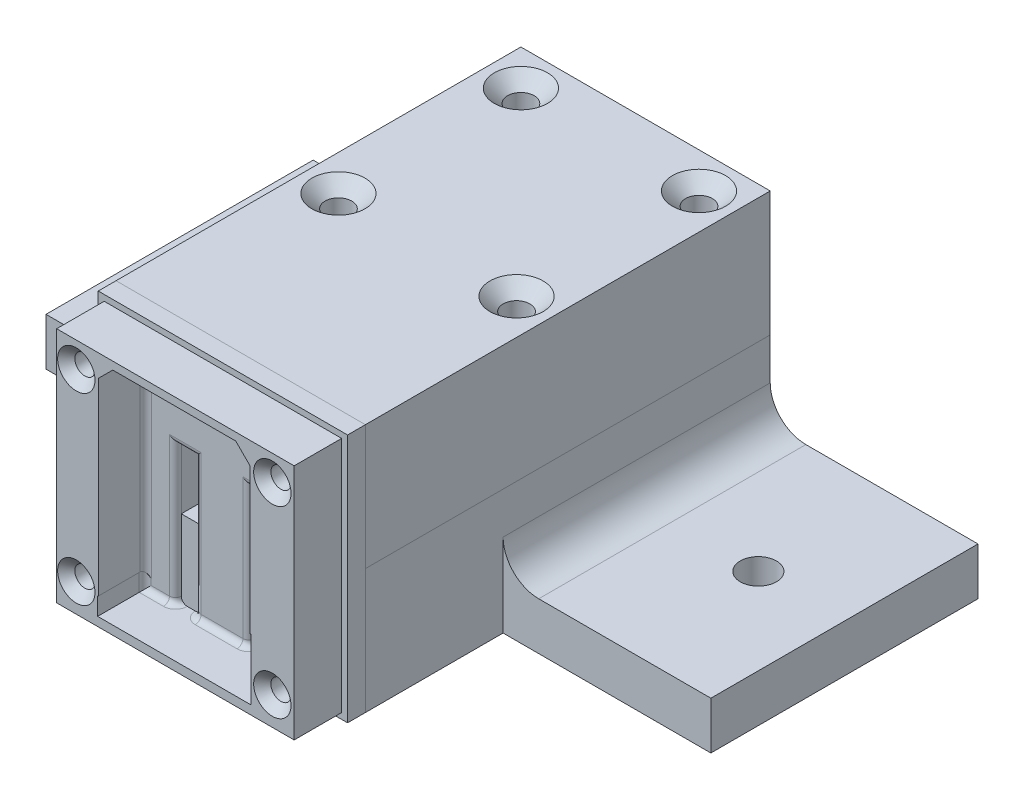
from build123d import *

# Parameters (mm, degrees)
BOSS_EXTRUDE1_DEPTH                          = 10
BOSS_EXTRUDE2_DEPTH                          = 10.1
BOSS_EXTRUDE3_DEPTH                          = 25
BOSS_EXTRUDE4_DEPTH                          = 10.1
BOSS_EXTRUDE5_DEPTH                          = 5
BOSS_EXTRUDE6_DEPTH                          = 8
SKETCH23_W                                   = 25
SKETCH23_H                                   = 12.5
BOSS_EXTRUDE10_DEPTH                         = 1
SKETCH11_W                                   = 42
SKETCH11_H                                   = 21
BOSS_EXTRUDE7_DEPTH                          = 3
BOSS_EXTRUDE14_START                         = -5.2
BOSS_EXTRUDE14_DEPTH                         = 5.2
CHAMFER1_SIZE                                = 2
SKETCH15_R                                   = 2.5
BOSS_EXTRUDE8_DEPTH                          = 3
SKETCH16_R                                   = 1.75
BOSS_EXTRUDE9_DEPTH                          = 2
CSK_FOR_M4_HEX_SOCKET_COUNTERSUNK_CA_2_COUNT = 2
CSK_FOR_M4_HEX_SOCKET_COUNTERSUNK_CA_2_PITCH = 30.736645967
CSK_FOR_M4_HEX_SOCKET_COUNTERSUNK_CA_3_COUNT = 2
CSK_FOR_M4_HEX_SOCKET_COUNTERSUNK_CA_3_PITCH = 42.950452911
CSK_FOR_M4_HEX_SOCKET_COUNTERSUNK_CA_4_COUNT = 2
CSK_FOR_M4_HEX_SOCKET_COUNTERSUNK_CA_4_PITCH = 30
SKETCH19_R                                   = 1.25
CUT_EXTRUDE1_DEPTH                           = 6
SKETCH28_W                                   = 45
SKETCH28_H                                   = 8
BOSS_EXTRUDE15_DEPTH                         = 35
SKETCH32_W                                   = 45
SKETCH32_H                                   = 8
BOSS_EXTRUDE16_DEPTH                         = 35
FILLET1_R                                    = 6
SKETCH31_R                                   = 3.05
CUT_EXTRUDE3_DEPTH                           = 35
SKETCH34_W                                   = 40
SKETCH34_H                                   = 40
BOSS_EXTRUDE17_DEPTH                         = 8
CUT_EXTRUDE2_DEPTH                           = 5
CUT_EXTRUDE2_DEPTH_BACK                      = 10
SKETCH20_W                                   = 3.943705391
SKETCH20_H                                   = 10.51654771
SKETCH20_W_2                                 = 3.341855227
SKETCH20_H_2                                 = 10.586808403
SKETCH37_W                                   = 23.5
SKETCH37_H                                   = 3.007435126
CUT_EXTRUDE5_DEPTH                           = 8
SKETCH38_W                                   = 3.341855227
SKETCH38_H                                   = 13.012197934
SKETCH38_W_2                                 = 3.943705391
SKETCH38_H_2                                 = 13.082458627
CUT_EXTRUDE6_DEPTH                           = 1
FILLET2_R                                    = 1
CUT_EXTRUDE7_DEPTH                           = 6
CSK_FOR_M3_COUNTERSUNK_FLAT_HEAD_SCR_2_COUNT = 2
CSK_FOR_M3_COUNTERSUNK_FLAT_HEAD_SCR_2_PITCH = 30.950031983
CSK_FOR_M3_COUNTERSUNK_FLAT_HEAD_SCR_3_COUNT = 2
CSK_FOR_M3_COUNTERSUNK_FLAT_HEAD_SCR_3_PITCH = 45.258406241
CSK_FOR_M3_COUNTERSUNK_FLAT_HEAD_SCR_4_COUNT = 2
CSK_FOR_M3_COUNTERSUNK_FLAT_HEAD_SCR_4_PITCH = 33.021490816
SKETCH43_R                                   = 1
BOSS_EXTRUDE18_DEPTH                         = 3
SKETCH43_2_R                                 = 1
CUT_EXTRUDE8_DEPTH                           = 3.2


with BuildPart() as part:
    # Sketch1 → Boss-Extrude1 (new body)
    with BuildSketch(Plane.XY):
        with BuildLine():
            Line((0, 21), (0, 0))
            Line((0, 0), (42, 0))
            Line((42, 0), (42, 21))
            Line((42, 21), (27.1, 21))
            ThreePointArc((27.1, 21), (21, 14.9), (14.9, 21))
            Line((14.9, 21), (0, 21))
        make_face()
    extrude(amount=BOSS_EXTRUDE1_DEPTH)

    # Sketch2 → Boss-Extrude2 (add)
    with BuildSketch(Plane.XY.offset(10)):
        with BuildLine():
            Line((0, 21), (0, 0))
            Line((0, 0), (42, 0))
            Line((42, 0), (42, 21))
            Line((42, 21), (37.2, 21))
            ThreePointArc((37.2, 21), (21, 4.8), (4.8, 21))
            Line((4.8, 21), (0, 21))
        make_face()
    extrude(amount=BOSS_EXTRUDE2_DEPTH)

    # Sketch3 → Boss-Extrude3 (add)
    with BuildSketch(Plane.XY.offset(20.1)):
        with BuildLine():
            Line((14.9, 21), (4.8, 21))
            ThreePointArc((4.8, 21), (21, 4.8), (37.2, 21))
            Line((37.2, 21), (27.1, 21))
            ThreePointArc((27.1, 21), (21, 14.9), (14.9, 21))
        make_face()
        with BuildLine():
            Line((42, 21), (37.2, 21))
            ThreePointArc((37.2, 21), (21, 4.8), (4.8, 21))
            Line((4.8, 21), (0, 21))
            Line((0, 21), (0, 0))
            Line((0, 0), (42, 0))
            Line((42, 0), (42, 21))
        make_face()
    extrude(amount=BOSS_EXTRUDE3_DEPTH)

    # Sketch4 → Boss-Extrude4 (add)
    with BuildSketch(Plane.XY.offset(45.1)):
        with BuildLine():
            Line((0, 21), (0, 0))
            Line((0, 0), (42, 0))
            Line((42, 0), (42, 21))
            Line((42, 21), (37.2, 21))
            ThreePointArc((37.2, 21), (21, 4.8), (4.8, 21))
            Line((4.8, 21), (0, 21))
        make_face()
    extrude(amount=BOSS_EXTRUDE4_DEPTH)

    # Sketch7 → Boss-Extrude5 (add)
    with BuildSketch(Plane.XY.offset(55.2)):
        with BuildLine():
            Line((14.9, 21), (4.8, 21))
            ThreePointArc((4.8, 21), (21, 4.8), (37.2, 21))
            Line((37.2, 21), (27.1, 21))
            ThreePointArc((27.1, 21), (21, 14.9), (14.9, 21))
        make_face()
        with BuildLine():
            Line((42, 21), (37.2, 21))
            ThreePointArc((37.2, 21), (21, 4.8), (4.8, 21))
            Line((4.8, 21), (0, 21))
            Line((0, 21), (0, 0))
            Line((0, 0), (42, 0))
            Line((42, 0), (42, 21))
        make_face()
    extrude(amount=BOSS_EXTRUDE5_DEPTH)

    # Sketch9 → Boss-Extrude6 (add)
    with BuildSketch(Plane.XY.offset(60.2)):
        Polygon((33.5, 21), (33.5, 8.5), (8.5, 8.5), (8.5, 21), (0, 21), (0, 0), (42, 0), (42, 21), align=None)
    extrude(amount=BOSS_EXTRUDE6_DEPTH)

    # Sketch11 → Boss-Extrude7 (add)
    with BuildSketch(Plane.XY.offset(68.2)):
        with Locations((21, 10.5)):
            Rectangle(SKETCH11_W, SKETCH11_H)
    extrude(amount=BOSS_EXTRUDE7_DEPTH)


with BuildPart() as body_2:
    # Sketch23 → Boss-Extrude10 (new body)
    with BuildSketch(Plane.XY.offset(68.2)):
        with Locations((21, 14.75)):
            Rectangle(SKETCH23_W, SKETCH23_H)
    extrude(amount=-BOSS_EXTRUDE10_DEPTH)


with BuildPart() as body_3:
    # Split1: the piece on the far side of the plane
    add(part.part)
    split(bisect_by=Plane(origin=(0, 0, 68.2), x_dir=(-1, 0, 0), z_dir=(0, 0, -1)), keep=Keep.BOTTOM)


with BuildPart() as part_1:
    add(part.part)

    # Split1
    split(bisect_by=Plane(origin=(0, 0, 68.2), x_dir=(-1, 0, 0), z_dir=(0, 0, -1)), keep=Keep.TOP)

    # Sketch27 → Boss-Extrude14 (add)
    with BuildSketch(Plane.XY.offset(BOSS_EXTRUDE14_START)):
        with BuildLine():
            ThreePointArc((11.363884136, 21), (21, 11.363884136), (30.636115864, 21))
            Line((30.636115864, 21), (27.1, 21))
            ThreePointArc((27.1, 21), (21, 14.9), (14.9, 21))
            Line((14.9, 21), (11.363884136, 21))
        make_face()
    extrude(amount=BOSS_EXTRUDE14_DEPTH)

    # Chamfer1
    chamfer1_edges = [part_1.edges().sort_by_distance(p)[0] for p in [
        (21, 11.363884136, -5.2),
    ]]
    chamfer(chamfer1_edges, length=CHAMFER1_SIZE)


with BuildPart() as body_4:
    # Mirror2: mirrored copy
    add(part_1.part.mirror(Plane(origin=(0, 21, 0), x_dir=(0, 0, 1), z_dir=(0, -1, 0))))


with BuildPart() as body_5:
    # Mirror2 2: mirrored copy
    add(body_2.part.mirror(Plane(origin=(0, 21, 0), x_dir=(0, 0, 1), z_dir=(0, -1, 0))))


with BuildPart() as body_6:
    # Mirror2 3: mirrored copy
    add(body_3.part.mirror(Plane(origin=(0, 21, 0), x_dir=(0, 0, 1), z_dir=(0, -1, 0))))

    # Combine1: union body 3, body 2, body 5
    add(body_3.part)
    add(body_2.part)
    add(body_5.part)

    # Sketch15 → Boss-Extrude8 (add)
    with BuildSketch(Plane(origin=(0, 0, 68.2), x_dir=(-1, 0, 0), z_dir=(0, 0, -1))):
        with Locations((-29, 29)):
            Circle(SKETCH15_R)
        with Locations((-13, 29)):
            Circle(SKETCH15_R)
        with Locations((-13, 13)):
            Circle(SKETCH15_R)
        with Locations((-29, 13)):
            Circle(SKETCH15_R)
    extrude(amount=BOSS_EXTRUDE8_DEPTH)

    # Sketch16 → Boss-Extrude9 (add)
    with BuildSketch(Plane(origin=(0, 0, 65.2), x_dir=(-1, 0, 0), z_dir=(0, 0, -1))):
        with Locations((-13, 13)):
            Circle(SKETCH16_R)
        with Locations((-29, 13)):
            Circle(SKETCH16_R)
        with Locations((-13, 29)):
            Circle(SKETCH16_R)
        with Locations((-29, 29)):
            Circle(SKETCH16_R)
    extrude(amount=BOSS_EXTRUDE9_DEPTH)

    # Sketch19 → Cut-Extrude1 (cut)
    with BuildSketch(Plane(origin=(0, 0, 63.2), x_dir=(-1, 0, 0), z_dir=(0, 0, -1))):
        with Locations((-29, 29)):
            Circle(SKETCH19_R)
        with Locations((-13, 29)):
            Circle(SKETCH19_R)
        with Locations((-13, 13)):
            Circle(SKETCH19_R)
        with Locations((-29, 13)):
            Circle(SKETCH19_R)
    extrude(amount=-CUT_EXTRUDE1_DEPTH, mode=Mode.SUBTRACT)

    # Sketch34 → Boss-Extrude17 (add)
    with BuildSketch(Plane.XY.offset(71.2)):
        with Locations((21, 21)):
            Rectangle(SKETCH34_W, SKETCH34_H)
    extrude(amount=BOSS_EXTRUDE17_DEPTH)

    # Sketch20 → Cut-Extrude2 (cut, two sides: drawn at the far end of the back side and taken through both)
    with BuildSketch(Plane(origin=(0, 0, 68.2), x_dir=(-1, 0, 0), z_dir=(0, 0, -1)).offset(-CUT_EXTRUDE2_DEPTH_BACK)):
        with Locations((-27.344221717, 20.828534548)):
            Rectangle(SKETCH20_W, SKETCH20_H)
        with Locations((-14.670927613, 20.793404202)):
            Rectangle(SKETCH20_W_2, SKETCH20_H_2)
    extrude(amount=CUT_EXTRUDE2_DEPTH + CUT_EXTRUDE2_DEPTH_BACK, mode=Mode.SUBTRACT)

    # Sketch37 → Cut-Extrude5 (cut)
    with BuildSketch(Plane.XY.offset(79.2)):
        with BuildLine():
            Line((16.453504002, 5.495237192), (25.653504002, 5.495237192))
            Line((25.653504002, 5.495237192), (25.653504002, 6.145237192))
            ThreePointArc((25.653504002, 6.145237192), (25.448478749, 6.640211939), (24.953504002, 6.845237192))
            Line((24.953504002, 6.845237192), (17.153504002, 6.845237192))
            ThreePointArc((17.153504002, 6.845237192), (16.658529255, 6.640211939), (16.453504002, 6.145237192))
            Line((16.453504002, 6.145237192), (16.453504002, 5.495237192))
        make_face()
        with Locations((19.653504002, 3.991519629)):
            Rectangle(SKETCH37_W, SKETCH37_H)
        with BuildLine():
            Line((32.603504002, 12.795237192), (33.703504002, 12.795237192))
            Line((33.703504002, 12.795237192), (33.703504002, 2.487802066))
            Line((33.703504002, 2.487802066), (31.403504002, 2.487802066))
            Line((31.403504002, 2.487802066), (31.403504002, 5.495237192))
            Line((31.403504002, 5.495237192), (31.403504002, 11.595237192))
            ThreePointArc((31.403504002, 11.595237192), (31.754975865, 12.44376533), (32.603504002, 12.795237192))
        make_face()
        with BuildLine():
            Line((32.603504002, 12.795237192), (33.603504002, 12.795237192))
            Line((33.603504002, 12.795237192), (33.603504002, 37.253815836))
            Line((33.603504002, 37.253815836), (31.162082646, 39.695237192))
            Line((31.162082646, 39.695237192), (10.444925358, 39.695237192))
            Line((10.444925358, 39.695237192), (8.003504002, 37.253815836))
            Line((8.003504002, 37.253815836), (8.003504002, 5.495237192))
            Line((8.003504002, 5.495237192), (16.453504002, 5.495237192))
            Line((16.453504002, 5.495237192), (16.453504002, 6.145237192))
            ThreePointArc((16.453504002, 6.145237192), (16.658529255, 6.640211939), (17.153504002, 6.845237192))
            Line((17.153504002, 6.845237192), (24.953504002, 6.845237192))
            ThreePointArc((24.953504002, 6.845237192), (25.448478749, 6.640211939), (25.653504002, 6.145237192))
            Line((25.653504002, 6.145237192), (25.653504002, 5.495237192))
            Line((25.653504002, 5.495237192), (31.403504002, 5.495237192))
            Line((31.403504002, 5.495237192), (31.403504002, 11.595237192))
            ThreePointArc((31.403504002, 11.595237192), (31.754975865, 12.44376533), (32.603504002, 12.795237192))
        make_face()
    extrude(amount=-CUT_EXTRUDE5_DEPTH, mode=Mode.SUBTRACT)

    # Sketch38 → Cut-Extrude6 (cut)
    with BuildSketch(Plane.XY.offset(71.2)):
        with Locations((14.670927613, 8.993901033)):
            Rectangle(SKETCH38_W, SKETCH38_H)
        with Locations((27.344221717, 9.02903138)):
            Rectangle(SKETCH38_W_2, SKETCH38_H_2)
    extrude(amount=-CUT_EXTRUDE6_DEPTH, mode=Mode.SUBTRACT)

    # Fillet2
    fillet2_edges = [body_6.edges().sort_by_distance(p)[0] for p in [
        (27.344221716, 26.086808403, 71.2),
        (10.451752001, 2.487802066, 71.2),
        (7.903504002, 3.991519629, 71.2),
        (8.003504002, 21.374526514, 71.2),
        (9.22421468, 38.474526514, 71.2),
        (20.803504002, 39.695237192, 71.2),
        (32.382793324, 38.474526514, 71.2),
        (33.603504002, 25.024526514, 71.2),
        (16.341855227, 14.287305234, 71.2),
        (14.670927613, 26.086808403, 71.2),
        (13, 14.287305234, 71.2),
        (29.316074412, 14.287305234, 71.2),
        (25.372369021, 14.287305234, 71.2),
        (33.653504002, 12.795237192, 71.2),
        (33.703504002, 7.641519629, 71.2),
        (7.953504002, 5.495237192, 71.2),
        (20.857112124, 2.487802066, 71.2),
        (31.509789207, 2.487802066, 71.2),
        (13, 2.487802066, 70.7),
        (16.341855227, 2.487802066, 70.7),
        (25.372369021, 2.487802066, 70.7),
        (29.316074412, 2.487802066, 70.7),
    ]]
    fillet(fillet2_edges, radius=FILLET2_R - 0.0001)  # a hair under: the kernel refuses the full size


with BuildPart() as csk_for_m4_hex_socket_countersunk_cap_sc_tool:
    # Sketch18 → CSK for M4 Hex Socket Countersunk Cap Screw1 (revolve)
    with BuildSketch(Plane(origin=(36, 42, 36.736645967), x_dir=(0, 0, 1), z_dir=(1, 0, 0))):
        Polygon((0, 0), (0, 42), (2.25, 42), (2.25, 2.23), (4.48, 0), align=None)
    csk_for_m4_hex_socket_countersunk_cap_sc = revolve(axis=Axis((36, 48.35, 36.736645967), (0, -1, 0)))


with BuildPart() as part_2:
    add(part_1.part)

    # CSK for M4 Hex Socket Countersunk Cap Screw1: cut by csk_for_m4_hex_socket_countersunk_cap_sc_tool
    add(csk_for_m4_hex_socket_countersunk_cap_sc_tool.part, mode=Mode.SUBTRACT)


with BuildPart() as body_4_1:
    add(body_4.part)

    # CSK for M4 Hex Socket Countersunk Cap Screw1: cut by csk_for_m4_hex_socket_countersunk_cap_sc_tool
    add(csk_for_m4_hex_socket_countersunk_cap_sc_tool.part, mode=Mode.SUBTRACT)


with BuildPart() as csk_for_m4_hex_socket_countersunk_ca_2_tool:
    # CSK for M4 Hex Socket Countersunk Ca 2: CSK for M4 Hex Socket Countersunk Cap Screw1 ×2
    with Locations(*[(0, 0, -i * CSK_FOR_M4_HEX_SOCKET_COUNTERSUNK_CA_2_PITCH) for i in range(1, CSK_FOR_M4_HEX_SOCKET_COUNTERSUNK_CA_2_COUNT)]):
        add(csk_for_m4_hex_socket_countersunk_cap_sc)


with BuildPart() as part_3:
    add(part_2.part)

    # CSK for M4 Hex Socket Countersunk Ca 2: cut by csk_for_m4_hex_socket_countersunk_ca_2_tool
    add(csk_for_m4_hex_socket_countersunk_ca_2_tool.part, mode=Mode.SUBTRACT)


with BuildPart() as body_4_2:
    add(body_4_1.part)

    # CSK for M4 Hex Socket Countersunk Ca 2: cut by csk_for_m4_hex_socket_countersunk_ca_2_tool
    add(csk_for_m4_hex_socket_countersunk_ca_2_tool.part, mode=Mode.SUBTRACT)


with BuildPart() as csk_for_m4_hex_socket_countersunk_ca_3_tool:
    # CSK for M4 Hex Socket Countersunk Ca 3: CSK for M4 Hex Socket Countersunk Cap Screw1 ×2
    with Locations(*[Vector(-0.6984792468178195, 0, -0.7156303108203366) * (i * CSK_FOR_M4_HEX_SOCKET_COUNTERSUNK_CA_3_PITCH) for i in range(1, CSK_FOR_M4_HEX_SOCKET_COUNTERSUNK_CA_3_COUNT)]):
        add(csk_for_m4_hex_socket_countersunk_cap_sc)


with BuildPart() as part_4:
    add(part_3.part)

    # CSK for M4 Hex Socket Countersunk Ca 3: cut by csk_for_m4_hex_socket_countersunk_ca_3_tool
    add(csk_for_m4_hex_socket_countersunk_ca_3_tool.part, mode=Mode.SUBTRACT)


with BuildPart() as body_4_3:
    add(body_4_2.part)

    # CSK for M4 Hex Socket Countersunk Ca 3: cut by csk_for_m4_hex_socket_countersunk_ca_3_tool
    add(csk_for_m4_hex_socket_countersunk_ca_3_tool.part, mode=Mode.SUBTRACT)


with BuildPart() as csk_for_m4_hex_socket_countersunk_ca_4_tool:
    # CSK for M4 Hex Socket Countersunk Ca 4: CSK for M4 Hex Socket Countersunk Cap Screw1 ×2
    with Locations(*[(-i * CSK_FOR_M4_HEX_SOCKET_COUNTERSUNK_CA_4_PITCH, 0, 0) for i in range(1, CSK_FOR_M4_HEX_SOCKET_COUNTERSUNK_CA_4_COUNT)]):
        add(csk_for_m4_hex_socket_countersunk_cap_sc)


with BuildPart() as part_5:
    add(part_4.part)

    # CSK for M4 Hex Socket Countersunk Ca 4: cut by csk_for_m4_hex_socket_countersunk_ca_4_tool
    add(csk_for_m4_hex_socket_countersunk_ca_4_tool.part, mode=Mode.SUBTRACT)

    # Sketch28 → Boss-Extrude15 (add)
    with BuildSketch(Plane(origin=(42, 0, 0), x_dir=(0, 0, -1), z_dir=(1, 0, 0))):
        with Locations((-22.5, 4)):
            Rectangle(SKETCH28_W, SKETCH28_H)
    extrude(amount=BOSS_EXTRUDE15_DEPTH)

    # Sketch32 → Boss-Extrude16 (add)
    with BuildSketch(Plane.ZY):
        with Locations((22.5, 4)):
            Rectangle(SKETCH32_W, SKETCH32_H)
    extrude(amount=BOSS_EXTRUDE16_DEPTH)

    # Fillet1
    fillet1_edges = [part_5.edges().sort_by_distance(p)[0] for p in [
        (42, 8, 22.5),
        (0, 8, 22.5),
    ]]
    fillet(fillet1_edges, radius=FILLET1_R)

    # Sketch31 → Cut-Extrude3 (cut)
    with BuildSketch(Plane(origin=(0, 8, 0), x_dir=(1, 0, 0), z_dir=(0, 1, 0))):
        with Locations(Location((62.5, -22.5, 0), (0, 0, 270))):
            Circle(SKETCH31_R)
        with Locations(Location((-20.5, -22.5, 0), (0, 0, 270))):
            Circle(SKETCH31_R)
    extrude(amount=-CUT_EXTRUDE3_DEPTH, mode=Mode.SUBTRACT)

    # Sketch40 → Cut-Extrude7 (cut)
    with BuildSketch(Plane.XZ):
        Polygon((7.994497654, 33.188480369), (10.070050371, 36.689848804), (8.075552718, 40.238014402), (4.005502346, 40.284811565), (1.929949629, 36.78344313), (3.924447282, 33.235277532), align=None)
        Polygon((38.319881831, 33.392150745), (40.056358741, 37.073474956), (37.736476909, 40.417970177), (33.680118169, 40.081141189), (31.943641259, 36.399816978), (34.263523091, 33.055321756), align=None)
        Polygon((39.669004054, 4.237640998), (39.360749693, 8.296271217), (35.691745639, 10.058630218), (32.330995946, 7.762359002), (32.639250307, 3.703728783), (36.308254361, 1.941369782), align=None)
        Polygon((10.070319398, 6), (8.035159699, 9.525), (3.964840301, 9.525), (1.929680602, 6), (3.964840301, 2.475), (8.035159699, 2.475), align=None)
    extrude(amount=-CUT_EXTRUDE7_DEPTH, mode=Mode.SUBTRACT)


with BuildPart() as body_4_4:
    add(body_4_3.part)

    # CSK for M4 Hex Socket Countersunk Ca 4: cut by csk_for_m4_hex_socket_countersunk_ca_4_tool
    add(csk_for_m4_hex_socket_countersunk_ca_4_tool.part, mode=Mode.SUBTRACT)


with BuildPart() as csk_for_m3_countersunk_flat_head_screw1_tool:
    # Sketch42 → CSK for M3 Countersunk Flat Head Screw1 (revolve)
    with BuildSketch(Plane(origin=(37.327969629, 36.718717031, 79.2), x_dir=(0, -1, 0), z_dir=(1, 0, 0))):
        Polygon((0, 0), (0, 26.021463052), (1.7, 25), (1.7, 1.45), (3.15, 0), align=None)
    csk_for_m3_countersunk_flat_head_screw1 = revolve(axis=Axis((37.327969629, 36.718717031, 85.55), (0, 0, -1)))


with BuildPart() as body_4_5:
    add(body_4_4.part)

    # CSK for M3 Countersunk Flat Head Screw1: cut by csk_for_m3_countersunk_flat_head_screw1_tool
    add(csk_for_m3_countersunk_flat_head_screw1_tool.part, mode=Mode.SUBTRACT)


with BuildPart() as body_6_1:
    add(body_6.part)

    # CSK for M3 Countersunk Flat Head Screw1: cut by csk_for_m3_countersunk_flat_head_screw1_tool
    add(csk_for_m3_countersunk_flat_head_screw1_tool.part, mode=Mode.SUBTRACT)


with BuildPart() as csk_for_m3_countersunk_flat_head_scr_2_tool:
    # CSK for M3 Countersunk Flat Head Scr 2: CSK for M3 Countersunk Flat Head Screw1 ×2
    with Locations(*[(0, -i * CSK_FOR_M3_COUNTERSUNK_FLAT_HEAD_SCR_2_PITCH, 0) for i in range(1, CSK_FOR_M3_COUNTERSUNK_FLAT_HEAD_SCR_2_COUNT)]):
        add(csk_for_m3_countersunk_flat_head_screw1)


with BuildPart() as part_6:
    add(part_5.part)

    # CSK for M3 Countersunk Flat Head Scr 2: cut by csk_for_m3_countersunk_flat_head_scr_2_tool
    add(csk_for_m3_countersunk_flat_head_scr_2_tool.part, mode=Mode.SUBTRACT)


with BuildPart() as body_6_2:
    add(body_6_1.part)

    # CSK for M3 Countersunk Flat Head Scr 2: cut by csk_for_m3_countersunk_flat_head_scr_2_tool
    add(csk_for_m3_countersunk_flat_head_scr_2_tool.part, mode=Mode.SUBTRACT)


with BuildPart() as csk_for_m3_countersunk_flat_head_scr_3_tool:
    # CSK for M3 Countersunk Flat Head Scr 3: CSK for M3 Countersunk Flat Head Screw1 ×2
    with Locations(*[Vector(-0.7296211590068749, -0.6838515660064431, 0) * (i * CSK_FOR_M3_COUNTERSUNK_FLAT_HEAD_SCR_3_PITCH) for i in range(1, CSK_FOR_M3_COUNTERSUNK_FLAT_HEAD_SCR_3_COUNT)]):
        add(csk_for_m3_countersunk_flat_head_screw1)


with BuildPart() as part_7:
    add(part_6.part)

    # CSK for M3 Countersunk Flat Head Scr 3: cut by csk_for_m3_countersunk_flat_head_scr_3_tool
    add(csk_for_m3_countersunk_flat_head_scr_3_tool.part, mode=Mode.SUBTRACT)

    # Sketch43 → Boss-Extrude18 (add)
    with BuildSketch(Plane(origin=(0, 21, 0), x_dir=(1, 0, 0), z_dir=(0, 1, 0))):
        with Locations(Location((5.524984009, -25.385623499, 0), (0, 0, 270))):
            Circle(SKETCH43_R)
        with Locations(Location((34.647258197, -28.066334931, 0), (0, 0, 270))):
            Circle(SKETCH43_R)
    extrude(amount=BOSS_EXTRUDE18_DEPTH)


with BuildPart() as body_6_3:
    add(body_6_2.part)

    # CSK for M3 Countersunk Flat Head Scr 3: cut by csk_for_m3_countersunk_flat_head_scr_3_tool
    add(csk_for_m3_countersunk_flat_head_scr_3_tool.part, mode=Mode.SUBTRACT)


with BuildPart() as csk_for_m3_countersunk_flat_head_scr_4_tool:
    # CSK for M3 Countersunk Flat Head Scr 4: CSK for M3 Countersunk Flat Head Screw1 ×2
    with Locations(*[(-i * CSK_FOR_M3_COUNTERSUNK_FLAT_HEAD_SCR_4_PITCH, 0, 0) for i in range(1, CSK_FOR_M3_COUNTERSUNK_FLAT_HEAD_SCR_4_COUNT)]):
        add(csk_for_m3_countersunk_flat_head_screw1)


with BuildPart() as body_4_6:
    add(body_4_5.part)

    # CSK for M3 Countersunk Flat Head Scr 4: cut by csk_for_m3_countersunk_flat_head_scr_4_tool
    add(csk_for_m3_countersunk_flat_head_scr_4_tool.part, mode=Mode.SUBTRACT)

    # Sketch43<2> → Cut-Extrude8 (cut)
    with BuildSketch(Plane(origin=(0, 21, 0), x_dir=(1, 0, 0), z_dir=(0, 1, 0))):
        with Locations(Location((5.524984009, -25.385623499, 0), (0, 0, 270))):
            Circle(SKETCH43_2_R)
        with Locations(Location((34.647258197, -28.066334931, 0), (0, 0, 270))):
            Circle(SKETCH43_2_R)
    extrude(amount=CUT_EXTRUDE8_DEPTH, mode=Mode.SUBTRACT)


with BuildPart() as body_6_4:
    add(body_6_3.part)

    # CSK for M3 Countersunk Flat Head Scr 4: cut by csk_for_m3_countersunk_flat_head_scr_4_tool
    add(csk_for_m3_countersunk_flat_head_scr_4_tool.part, mode=Mode.SUBTRACT)


solid = Compound([part_7.part, body_4_6.part, body_6_4.part])
